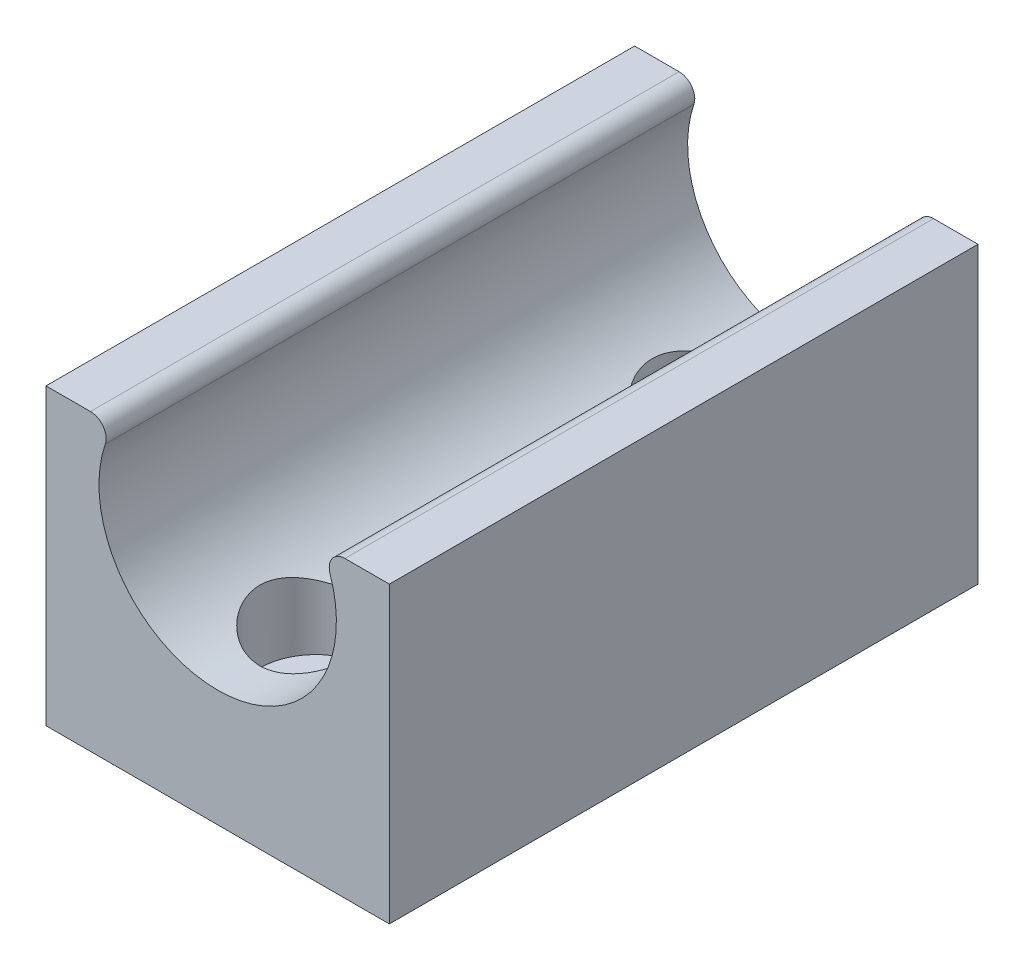
from build123d import *

# Parameters (mm, degrees)
BOSS_EXTRUDE1_DEPTH = 30
FILLET1_R           = 0.8
SKETCH3_R           = 2.85
CUT_EXTRUDE1_DEPTH  = 12
SKETCH4_R           = 1.55
CUT_EXTRUDE2_DEPTH  = 35.663561646


with BuildPart() as part:
    # Sketch1 → Boss-Extrude1 (new body)
    with BuildSketch(Plane.XY):
        with BuildLine():
            Line((-5.25, 7.5), (-8.75, 7.5))
            Line((-8.75, 7.5), (-8.75, -7.5))
            Line((-8.75, -7.5), (8.75, -7.5))
            Line((8.75, -7.5), (8.75, 7.5))
            Line((8.75, 7.5), (5.25, 7.5))
            ThreePointArc((5.25, 7.5), (0, -1.556659276), (-5.25, 7.5))
        make_face()
    extrude(amount=BOSS_EXTRUDE1_DEPTH)

    # Fillet1
    fillet1_edges = [part.edges().sort_by_distance(p)[0] for p in [
        (5.25, 7.5, 15),
        (-5.25, 7.5, 15),
    ]]
    fillet(fillet1_edges, radius=FILLET1_R)

    # Sketch3 → Cut-Extrude1 (cut)
    with BuildSketch(Plane(origin=(0, 7.5, 0), x_dir=(1, 0, 0), z_dir=(0, 1, 0))):
        with Locations((0, -5)):
            Circle(SKETCH3_R)
        with Locations((0, -25)):
            Circle(SKETCH3_R)
    extrude(amount=-CUT_EXTRUDE1_DEPTH, mode=Mode.SUBTRACT)

    # Sketch4 → Cut-Extrude2 (cut, through all)
    with BuildSketch(Plane(origin=(0, 7.5, 0), x_dir=(1, 0, 0), z_dir=(0, 1, 0))):
        with Locations((0, -5)):
            Circle(SKETCH4_R)
        with Locations((0, -25)):
            Circle(SKETCH4_R)
    extrude(amount=-CUT_EXTRUDE2_DEPTH, mode=Mode.SUBTRACT)


solid = part.part
